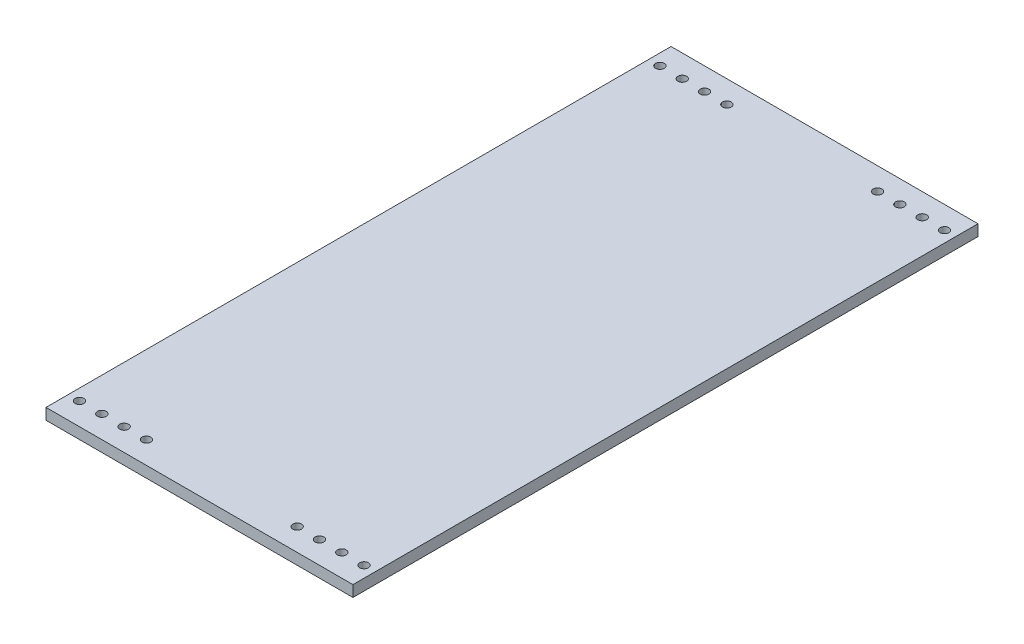
from build123d import *

# Parameters (mm, degrees)
SKETCH1_W           = 174.625
SKETCH1_H           = 355.6
BOSS_EXTRUDE1_DEPTH = 6.35
SKETCH2_R           = 2.4892
CUT_EXTRUDE2_DEPTH  = 199.183337232


with BuildPart() as part:
    # Sketch1 → Boss-Extrude1 (new body)
    with BuildSketch(Plane(origin=(0, 0, 0), x_dir=(1, 0, 0), z_dir=(0, 1, 0))):
        Rectangle(SKETCH1_W, SKETCH1_H)
    extrude(amount=BOSS_EXTRUDE1_DEPTH)

    # Sketch2 → Cut-Extrude2 (cut, through all)
    with BuildSketch(Plane(origin=(0, 6.35, 0), x_dir=(1, 0, 0), z_dir=(0, 1, 0))):
        with Locations((80.9625, -165.1)):
            Circle(SKETCH2_R)
        with Locations((68.2625, -165.1)):
            Circle(SKETCH2_R)
        with Locations((55.5625, -165.1)):
            Circle(SKETCH2_R)
        with Locations((42.8625, -165.1)):
            Circle(SKETCH2_R)
        with Locations((80.9625, 165.1)):
            Circle(SKETCH2_R)
        with Locations((68.2625, 165.1)):
            Circle(SKETCH2_R)
        with Locations((55.5625, 165.1)):
            Circle(SKETCH2_R)
        with Locations((42.8625, 165.1)):
            Circle(SKETCH2_R)
        with Locations((-80.9625, -165.1)):
            Circle(SKETCH2_R)
        with Locations((-68.2625, -165.1)):
            Circle(SKETCH2_R)
        with Locations((-55.5625, -165.1)):
            Circle(SKETCH2_R)
        with Locations((-42.8625, -165.1)):
            Circle(SKETCH2_R)
        with Locations((-80.9625, 165.1)):
            Circle(SKETCH2_R)
        with Locations((-68.2625, 165.1)):
            Circle(SKETCH2_R)
        with Locations((-55.5625, 165.1)):
            Circle(SKETCH2_R)
        with Locations((-42.8625, 165.1)):
            Circle(SKETCH2_R)
    extrude(amount=-CUT_EXTRUDE2_DEPTH, mode=Mode.SUBTRACT)


solid = part.part
